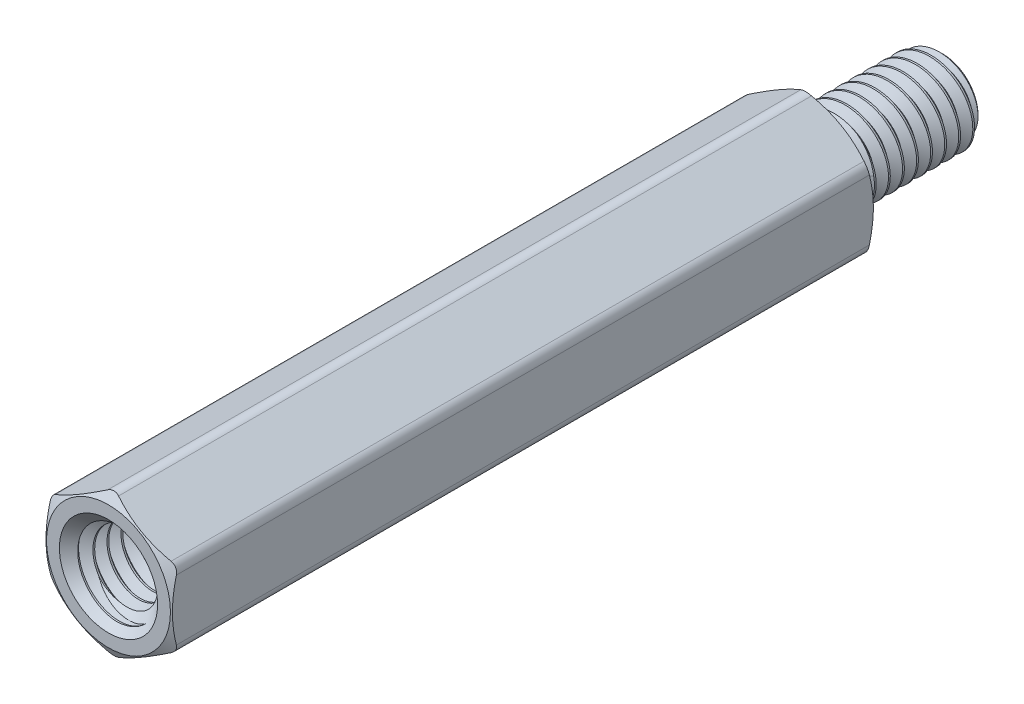
from build123d import *

# Parameters (mm, degrees)
SKETCH4_R           = 1.875
BOSS_EXTRUDE1_DEPTH = 25
SKETCH5_OUTSIDE_W   = 119.632
SKETCH5_OUTSIDE_H   = 120.328
SKETCH5_OUTSIDE_R   = 2.205
CUT_EXTRUDE1_DEPTH  = 30.898202287
CUT_EXTRUDE1_DRAFT  = -60
SKETCH6_OUTSIDE_W   = 103.478
SKETCH6_OUTSIDE_H   = 104.174
SKETCH6_OUTSIDE_R   = 2.205
CUT_EXTRUDE2_DEPTH  = 26.235144145
CUT_EXTRUDE2_DRAFT  = -60
FILLET1_R           = 0.3825
CUT_SWEEP1_PITCH    = 0.5
SKETCH9_R           = 1.75
BOSS_EXTRUDE2_DEPTH = 6.4
SKETCH10_W          = 6.4
SKETCH10_H          = 1.5
CUT_SWEEP2_PITCH    = 0.5


with BuildPart() as part:
    # Sketch3 → Revolve1 (revolve)
    with BuildSketch(Plane(origin=(0, 0, 0), x_dir=(0, 0, -1), z_dir=(1, 0, 0))):
        with BuildLine():
            Line((-18.6, 1.25), (-18.6, 0))
            Line((-18.6, 0), (4.7, 0))
            Line((4.7, 0), (4.7, 1.25))
            Line((4.7, 1.25), (4.45, 1.5))
            Line((4.45, 1.5), (0.7515, 1.5))
            Line((0.7515, 1.5), (0.564, 1.175240474))
            Line((0.564, 1.175240474), (0.25, 1.175240474))
            ThreePointArc((0.25, 1.175240474), (0.073223305, 1.248463778), (0, 1.425240474))
            Line((0, 1.425240474), (0, 2.25))
            Line((0, 2.25), (-25, 2.25))
            Line((-25, 2.25), (-25, 1.75))
            Line((-25, 1.75), (-24.75, 1.5))
            Line((-24.75, 1.5), (-18.85, 1.5))
            Line((-18.85, 1.5), (-18.6, 1.25))
        make_face()
    revolve(axis=Axis((0, 0, -4.7), (0, 0, 1)))

    # Sketch4 → Boss-Extrude1 (add)
    with BuildSketch(Plane.XY.offset(25)):
        Polygon((-2.25, 1.299038106), (-2.25, -1.299038106), (0, -2.598076211), (2.25, -1.299038106), (2.25, 1.299038106), (0, 2.598076211), align=None)
        Circle(SKETCH4_R, mode=Mode.SUBTRACT)
    extrude(amount=-BOSS_EXTRUDE1_DEPTH)


with BuildPart() as cut_extrude1_tool:
    # Sketch5 outside → Cut-Extrude1 (with draft: the straight prism first)
    with BuildSketch(Plane.XY.offset(25)):
        Rectangle(SKETCH5_OUTSIDE_W, SKETCH5_OUTSIDE_H)
        Circle(SKETCH5_OUTSIDE_R, mode=Mode.SUBTRACT)
    extrude(amount=-CUT_EXTRUDE1_DEPTH)
    # Cut-Extrude1: the draft: its side faces are tilted about the plane it starts from
    cut_extrude1_sides = [cut_extrude1_tool.faces().sort_by_distance(p)[0] for p in [
        (0, -60.164, 9.550898856),
        (59.816, 0, 9.550898856),
        (0, 60.164, 9.550898856),
        (-59.816, 0, 9.550898856),
        (-2.205, 0, 9.550898856),
    ]]
    draft(cut_extrude1_sides, Plane.XY.offset(25), CUT_EXTRUDE1_DRAFT)


with BuildPart() as part_1:
    add(part.part)

    # Cut-Extrude1: cut by cut_extrude1_tool
    add(cut_extrude1_tool.part, mode=Mode.SUBTRACT)


with BuildPart() as cut_extrude2_tool:
    # Sketch6 outside → Cut-Extrude2 (with draft: the straight prism first)
    with BuildSketch(Plane(origin=(0, 0, 0), x_dir=(-1, 0, 0), z_dir=(0, 0, -1))):
        Rectangle(SKETCH6_OUTSIDE_W, SKETCH6_OUTSIDE_H)
        Circle(SKETCH6_OUTSIDE_R, mode=Mode.SUBTRACT)
    extrude(amount=-CUT_EXTRUDE2_DEPTH)
    # Cut-Extrude2: the draft: its side faces are tilted about the plane it starts from
    cut_extrude2_sides = [cut_extrude2_tool.faces().sort_by_distance(p)[0] for p in [
        (0, -52.087, 13.117572072),
        (-51.739, 0, 13.117572072),
        (0, 52.087, 13.117572072),
        (51.739, 0, 13.117572072),
        (2.205, 0, 13.117572072),
    ]]
    draft(cut_extrude2_sides, Plane(origin=(0, 0, 0), x_dir=(-1, 0, 0), z_dir=(0, 0, -1)), CUT_EXTRUDE2_DRAFT)


with BuildPart() as part_2:
    add(part_1.part)

    # Cut-Extrude2: cut by cut_extrude2_tool
    add(cut_extrude2_tool.part, mode=Mode.SUBTRACT)

    # Fillet1
    fillet1_edges = [part_2.edges().sort_by_distance(p)[0] for p in [
        (0, 2.598076211, 12.5),
        (-2.25, -1.299038106, 12.5),
        (0, -2.598076211, 12.5),
        (2.25, -1.299038106, 12.5),
        (2.25, 1.299038106, 12.5),
        (-2.25, 1.299038106, 12.5),
    ]]
    fillet(fillet1_edges, radius=FILLET1_R)

    # Cut-Sweep1: the profile of Sketch7 profile screwed along a right-hand helix of 9.118 turns, 6 arcs to a turn; built about Z, then put on its axis
    cut_sweep1_z = Axis((0, 0, 0), (0, 0, 1))
    cut_sweep1_corners = [(1.174940474, 0, -0.187673205), (1.174940474, 0, -0.249826795), (1.527063294, 0, -0.453125), (1.527063294, 0, 0.015625)]
    with BuildLine(mode=Mode.PRIVATE) as cut_sweep1_profile:
        Line(cut_sweep1_corners[0], cut_sweep1_corners[1])
        Line(cut_sweep1_corners[1], cut_sweep1_corners[2])
        Line(cut_sweep1_corners[2], cut_sweep1_corners[3])
        Line(cut_sweep1_corners[3], cut_sweep1_corners[0])
    cut_sweep1_cap = Face(cut_sweep1_profile.wire())
    cut_sweep1_turn_angles = [0, 30, 60, 90, 120, 150, 180, 210, 240, 270, 300, 330, 360]
    cut_sweep1_turn_weights = [1, 0.8660254037844387, 1, 0.8660254037844387, 1, 0.8660254037844387, 1, 0.8660254037844387, 1, 0.8660254037844387, 1, 0.8660254037844387, 1]
    cut_sweep1_turn_rails = [Edge.make_bspline([Vector(p[0], p[1], 0).rotate(cut_sweep1_z, cut_sweep1_turn_angles[k]) / cut_sweep1_turn_weights[k] + Vector(0, 0, p[2] + CUT_SWEEP1_PITCH * cut_sweep1_turn_angles[k] / 360) for k in range(13)], [0, 0, 0, 1, 1, 2, 2, 3, 3, 4, 4, 5, 5, 6, 6, 6], 2, cut_sweep1_turn_weights) for p in cut_sweep1_corners]
    cut_sweep1_turn_sides = [Face.make_surface_from_curves(cut_sweep1_turn_rails[p[0]], cut_sweep1_turn_rails[p[1]]) for p in [(0, 1), (1, 2), (2, 3), (3, 0)]]
    cut_sweep1_last_angles = [3240, 3261.24, 3282.48]
    cut_sweep1_last_weights = [1, 0.932071112458198, 1]
    cut_sweep1_last_rails = [Edge.make_bspline([Vector(p[0], p[1], 0).rotate(cut_sweep1_z, cut_sweep1_last_angles[k]) / cut_sweep1_last_weights[k] + Vector(0, 0, p[2] + CUT_SWEEP1_PITCH * cut_sweep1_last_angles[k] / 360) for k in range(3)], [0, 0, 0, 1, 1, 1], 2, cut_sweep1_last_weights) for p in cut_sweep1_corners]
    cut_sweep1_last_sides = [Face.make_surface_from_curves(cut_sweep1_last_rails[p[0]], cut_sweep1_last_rails[p[1]]) for p in [(0, 1), (1, 2), (2, 3), (3, 0)]]
    cut_sweep1 = Plane(origin=(0, 0, -4.7), x_dir=(0, 1, 0), z_dir=(0, 0, 1)) * Solid(Shell([*[p.moved(Location((0, 0, CUT_SWEEP1_PITCH * i))) for i in range(9) for p in cut_sweep1_turn_sides], *cut_sweep1_last_sides, cut_sweep1_cap, cut_sweep1_cap.rotate(cut_sweep1_z, 3282.48).moved(Location((0, 0, CUT_SWEEP1_PITCH * 3282.48 / 360)))]))
    add(cut_sweep1, mode=Mode.SUBTRACT)

    # Sketch9 → Boss-Extrude2 (add)
    with BuildSketch(Plane.XY.offset(18.6)):
        Circle(SKETCH9_R)
    extrude(amount=BOSS_EXTRUDE2_DEPTH)


with BuildPart() as body_2:
    # Sketch10 → Revolve2 (revolve)
    with BuildSketch(Plane(origin=(0, 0, 0), x_dir=(0, 0, -1), z_dir=(1, 0, 0))):
        with Locations((-21.8, 0.75)):
            Rectangle(SKETCH10_W, SKETCH10_H)
    revolve(axis=Axis((0, 0, -4.7), (0, 0, 1)))

    # Cut-Sweep2: the profile of Sketch12 profile screwed along a right-hand helix of 13.8 turns, 6 arcs to a turn; built about Z, then put on its axis
    cut_sweep2_z = Axis((0, 0, 0), (0, 0, 1))
    cut_sweep2_corners = [(1.174940474, 0, -0.249826795), (1.174940474, 0, -0.187673205), (1.527063294, 0, 0.015625), (1.527063294, 0, -0.453125)]
    with BuildLine(mode=Mode.PRIVATE) as cut_sweep2_profile:
        Line(cut_sweep2_corners[0], cut_sweep2_corners[1])
        Line(cut_sweep2_corners[1], cut_sweep2_corners[2])
        Line(cut_sweep2_corners[2], cut_sweep2_corners[3])
        Line(cut_sweep2_corners[3], cut_sweep2_corners[0])
    cut_sweep2_cap = Face(cut_sweep2_profile.wire())
    cut_sweep2_turn_angles = [0, 30, 60, 90, 120, 150, 180, 210, 240, 270, 300, 330, 360]
    cut_sweep2_turn_weights = [1, 0.8660254037844387, 1, 0.8660254037844387, 1, 0.8660254037844387, 1, 0.8660254037844387, 1, 0.8660254037844387, 1, 0.8660254037844387, 1]
    cut_sweep2_turn_rails = [Edge.make_bspline([Vector(p[0], p[1], 0).rotate(cut_sweep2_z, cut_sweep2_turn_angles[k]) / cut_sweep2_turn_weights[k] + Vector(0, 0, p[2] + CUT_SWEEP2_PITCH * cut_sweep2_turn_angles[k] / 360) for k in range(13)], [0, 0, 0, 1, 1, 2, 2, 3, 3, 4, 4, 5, 5, 6, 6, 6], 2, cut_sweep2_turn_weights) for p in cut_sweep2_corners]
    cut_sweep2_turn_sides = [Face.make_surface_from_curves(cut_sweep2_turn_rails[p[0]], cut_sweep2_turn_rails[p[1]]) for p in [(0, 1), (1, 2), (2, 3), (3, 0)]]
    cut_sweep2_last_angles = [4680, 4710, 4740, 4770, 4800, 4830, 4860, 4890, 4920, 4944, 4968]
    cut_sweep2_last_weights = [1, 0.8660254037844387, 1, 0.8660254037844387, 1, 0.8660254037844387, 1, 0.8660254037844387, 1, 0.9135454576426073, 1]
    cut_sweep2_last_rails = [Edge.make_bspline([Vector(p[0], p[1], 0).rotate(cut_sweep2_z, cut_sweep2_last_angles[k]) / cut_sweep2_last_weights[k] + Vector(0, 0, p[2] + CUT_SWEEP2_PITCH * cut_sweep2_last_angles[k] / 360) for k in range(11)], [0, 0, 0, 1, 1, 2, 2, 3, 3, 4, 4, 5, 5, 5], 2, cut_sweep2_last_weights) for p in cut_sweep2_corners]
    cut_sweep2_last_sides = [Face.make_surface_from_curves(cut_sweep2_last_rails[p[0]], cut_sweep2_last_rails[p[1]]) for p in [(0, 1), (1, 2), (2, 3), (3, 0)]]
    cut_sweep2 = Plane(origin=(0, 0, 25), x_dir=(0, 1, 0), z_dir=(0, 0, -1)) * Solid(Shell([*[p.moved(Location((0, 0, CUT_SWEEP2_PITCH * i))) for i in range(13) for p in cut_sweep2_turn_sides], *cut_sweep2_last_sides, cut_sweep2_cap, cut_sweep2_cap.rotate(cut_sweep2_z, 4968).moved(Location((0, 0, CUT_SWEEP2_PITCH * 4968 / 360)))]))
    add(cut_sweep2, mode=Mode.SUBTRACT)


with BuildPart() as part_3:
    add(part_2.part)

    # Combine1: cut body 2
    add(body_2.part, mode=Mode.SUBTRACT)

    # Cut-Extrude3 cone 1 section (through the dimple's axis) → Cut-Extrude3 (revolve, cut)
    with BuildSketch(Plane(origin=(0, 0, 25), x_dir=(0, -1, 0), z_dir=(1, 0, 0))):
        Polygon((0, 0), (1.7475, 0), (0, 1.7475), align=None)
    revolve(axis=Axis((0, 0, 25), (0, 0, -1)), mode=Mode.SUBTRACT)


solid = part_3.part
